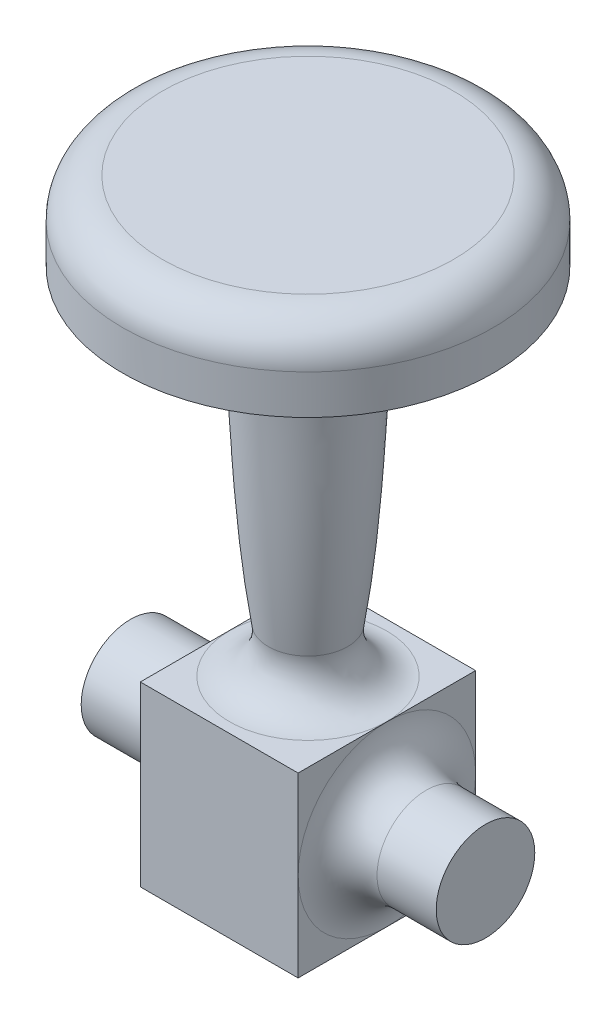
from build123d import *

# Parameters (mm, degrees)
SKETCH2_W          = 11.43
SKETCH2_H          = 11.43
CENTRAL_BOX_DEPTH  = 10.16
NIBBLES_DEPTH      = 6.35
NIBBLES_DEPTH_BACK = 16.51
SKETCH4_R          = 3.175
YAY_ROUNDED_R      = 2.54


with BuildPart() as part:
    # Sketch2 → central box (new body)
    with BuildSketch(Plane(origin=(0, 0, 0), x_dir=(0, 0, -1), z_dir=(1, 0, 0))):
        with Locations((5.715, 5.715)):
            Rectangle(SKETCH2_W, SKETCH2_H)
    extrude(amount=CENTRAL_BOX_DEPTH)

    # Sketch4 → nibbles (add, two sides: drawn at the far end of the back side and taken through both)
    with BuildSketch(Plane(origin=(10.16, 0, 0), x_dir=(0, 0, -1), z_dir=(1, 0, 0)).offset(-NIBBLES_DEPTH_BACK)):
        with Locations(Location((5.715, 5.715, 0), (0, 0, 180))):
            Circle(SKETCH4_R)
    extrude(amount=NIBBLES_DEPTH + NIBBLES_DEPTH_BACK)

    # Sketch6 → stick (revolve)
    with BuildSketch(Plane.XY.offset(-5.715), mode=Mode.PRIVATE) as stick_sk:
        with BuildLine():
            Line((5.08, 11.43), (5.08, 39.37))
            Line((5.08, 39.37), (17.007592302, 39.37))
            Line((17.007592302, 39.37), (17.007592302, 34.29))
            add(Edge.make_bspline(
                [(17.007592302, 34.29), (5.959076516, 41.944088777), (10.418992682, 27.645249109), (7.112, 11.43)],
                knots=[0, 0, 0, 0, 1, 1, 1, 1], degree=3))
            Line((7.112, 11.43), (5.08, 11.43))
        make_face()
    revolve(stick_sk.sketch.rotate(Axis((5.08, 11.43, -5.715), (0, 1, 0)), 90), axis=Axis((5.08, 11.43, -5.715), (0, 1, 0)))

    # yay, rounded
    yay_rounded_edges = [part.edges().sort_by_distance(p)[0] for p in [
        (0, 5.715, -8.89),
        (10.16, 5.715, -8.89),
        (5.08, 11.43, -3.683),
        (5.08, 39.37, 6.212592302),
    ]]
    fillet(yay_rounded_edges, radius=YAY_ROUNDED_R - 0.0001)  # a hair under: the kernel refuses the full size


solid = part.part
